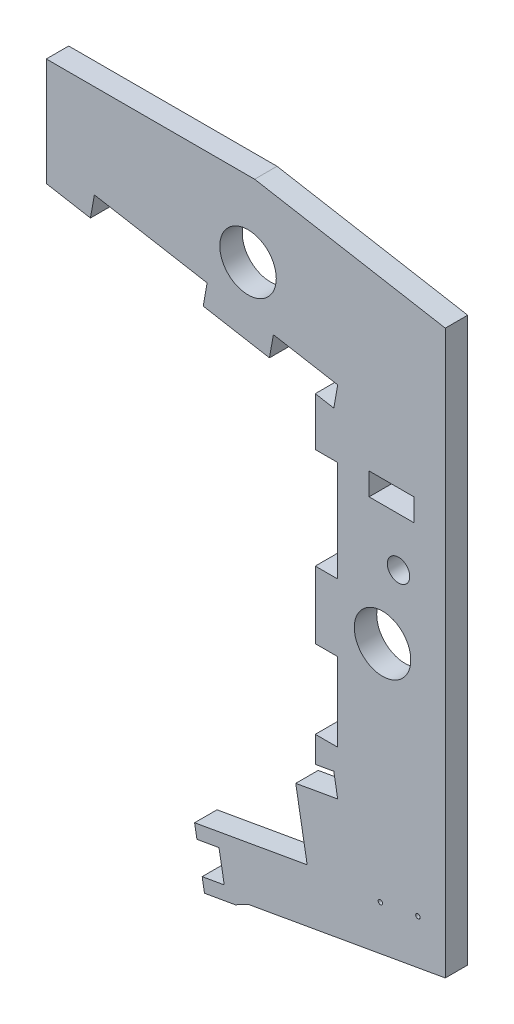
from build123d import *

# Parameters (mm, degrees)
ESQUISSE1_R             = 6.3
ESQUISSE1_R_2           = 2.5
BOSS_EXTRU_1_DEPTH      = 5
ESQUISSE2_R             = 0.5
ESQUISSE2_W             = 10
ESQUISSE2_H             = 5
ENL_V_MAT_EXTRU_1_DEPTH = 5
ESQUISSE3_W             = 5
ESQUISSE3_H             = 15
BOSS_EXTRU_3_DEPTH      = 5
ENL_V_MAT_EXTRU_2_DEPTH = 5


with BuildPart() as part:
    # Esquisse1 → Boss.-Extru.1 (new body)
    with BuildSketch(Plane.XY):
        Polygon((-65, 51.461253746), (0, 40), (0, -40), (-9.359100785, -41.650261983), (-6.809077296, -56.112163836), (-31.918247866, -60.539588071), (-29.710027076, -73.063030491), (25, -63.416176602), (25, 63.800831685), (-18.444412366, 71.461253746), (-65, 71.461253746), align=None)
        with Locations((-20, 53.680805733)):
            Circle(ESQUISSE1_R, mode=Mode.SUBTRACT)
        with Locations((10, -5)):
            Circle(ESQUISSE1_R, mode=Mode.SUBTRACT)
        with Locations((13.572008954, 11)):
            Circle(ESQUISSE1_R_2, mode=Mode.SUBTRACT)
    extrude(amount=BOSS_EXTRU_1_DEPTH)

    # Esquisse2 → Enlèv. mat.-Extru.1 (cut)
    with BuildSketch(Plane(origin=(0, 0, 0), x_dir=(-1, 0, 0), z_dir=(0, 0, -1))):
        with Locations((-9.52419964, -55.169092692)):
            Circle(ESQUISSE2_R)
        with Locations((-17.895065541, -53.693083181)):
            Circle(ESQUISSE2_R)
        Polygon((31.396602506, -63.497985917), (30.230971609, -70.108607232), (25.306932844, -69.240366344), (26.472563741, -62.629745029), align=None)
        with Locations((-12, 24.371704477)):
            Rectangle(ESQUISSE2_W, ESQUISSE2_H)
    extrude(amount=-ENL_V_MAT_EXTRU_1_DEPTH, mode=Mode.SUBTRACT)

    # Esquisse3 → Boss.-Extru.3 (add)
    with BuildSketch(Plane.XY):
        Polygon((0, -40), (0, -30), (-5, -30), (-5, -35.804501844), (-0.868240888, -35.075961235), align=None)
        with Locations((-2.5, -5)):
            Rectangle(ESQUISSE3_W, ESQUISSE3_H)
        Polygon((-0.868240888, 35.075961235), (0, 40), (0, 25), (-5, 25), (-5, 35.804501844), align=None)
        Polygon((-29.122539924, 45.135089535), (-14.350423629, 42.53036687), (-15.218664517, 37.606328105), (-29.990780813, 40.21105077), align=None)
        Polygon((-65, 51.461253746), (-65, 46.384120687), (-55.15192247, 44.64763891), (-54.283681582, 49.571677675), align=None)
    extrude(amount=BOSS_EXTRU_3_DEPTH)

    # Esquisse4 → Enlèv. mat.-Extru.2 (cut)
    with BuildSketch(Plane.XY.offset(5)):
        Polygon((-65, 70.461253746), (-18.53190103, 70.461253746), (24, 62.961732054), (24, -62.577076971), (-19.896838409, -70.317273951), (-22.829305917, -71.849773704), (35.229849594, -71.849773704), (35.229849594, 79.02138685), (-65, 79.02138685), align=None)
    extrude(amount=-ENL_V_MAT_EXTRU_2_DEPTH, mode=Mode.SUBTRACT)


solid = part.part
